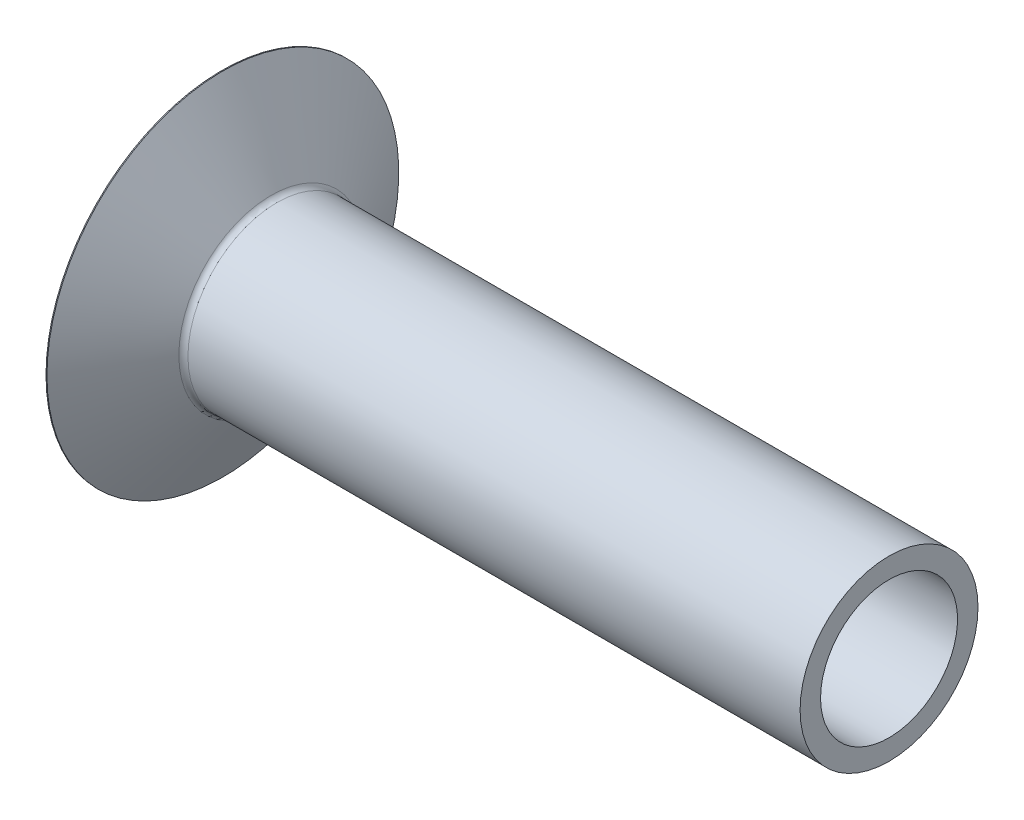
from build123d import *


with BuildPart() as part:
    # Sketch1 → Base-Revolve (revolve)
    with BuildSketch(Plane.XY):
        with BuildLine():
            Line((30, 0), (30, 4))
            Line((30, 4), (2.473205081, 4))
            ThreePointArc((2.473205081, 4), (2.323205081, 4.040192379), (2.21339746, 4.15))
            Line((2.21339746, 4.15), (0.042560447, 7.91))
            Line((0.042560447, 7.91), (0, 7.91))
            Line((0, 7.91), (0, 0))
            Line((0, 0), (30, 0))
        make_face()
    revolve(axis=Axis((-55.411731844, 0, 0), (1, 0, 0)))

    # Sketch3 → Cut-Revolve1 (revolve, cut)
    with BuildSketch(Plane.XY):
        Polygon((30, 3.08), (21.65, 3.08), (19.871761171, 0), (30, 0), align=None)
    revolve(axis=Axis((-6.108007449, 0, 0), (1, 0, 0)), mode=Mode.SUBTRACT)


solid = part.part
